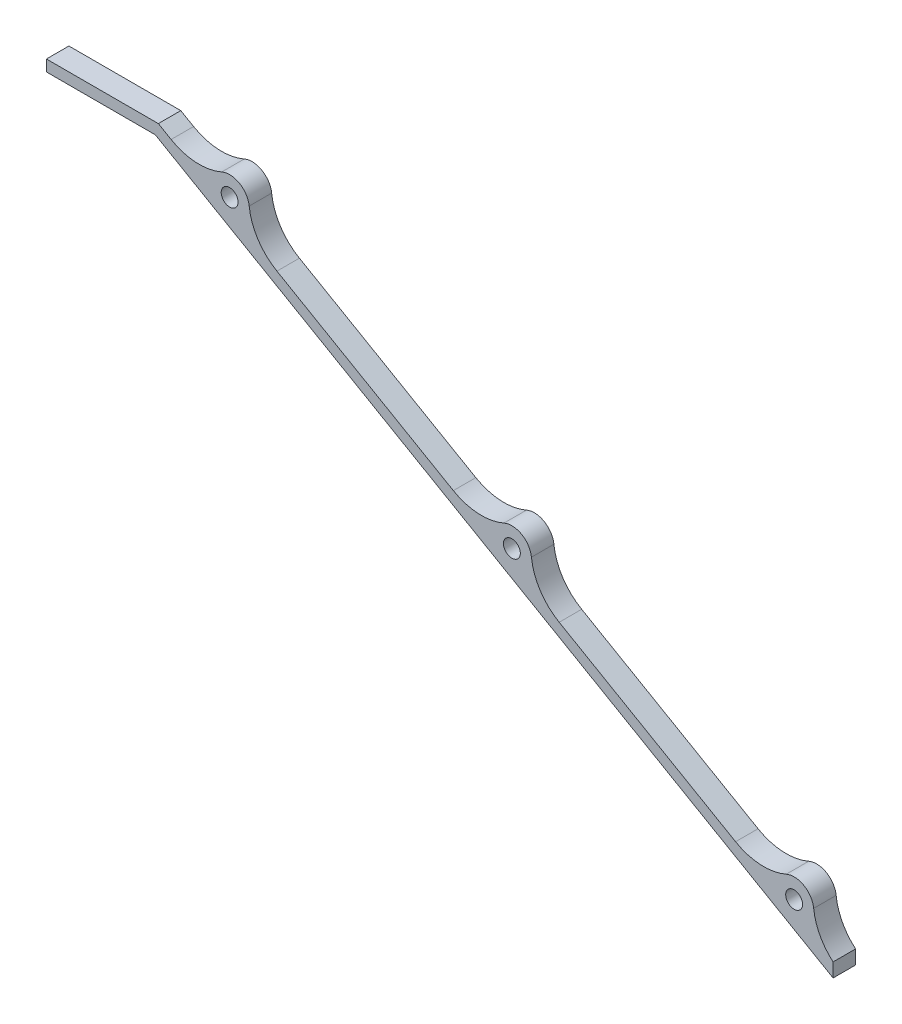
from build123d import *

# Parameters (mm, degrees)
EXTRUDE_THIN1_DEPTH = 4
SKETCH4_R           = 1.5
BOSS_EXTRUDE1_DEPTH = 4
FILLET1_DEPTH       = 4
CUT_EXTRUDE2_START  = -4
CUT_EXTRUDE2_DEPTH  = 4


with BuildPart() as part:
    # Sketch1 → Extrude-Thin1 (new body)
    with BuildSketch(Plane.XY):
        Polygon((-70, 98), (-50.621778265, 98), (70, 28.358983849), (71, 30.091034656), (-50.08587988, 100), (-70, 100), align=None)
    extrude(amount=EXTRUDE_THIN1_DEPTH)

    # Sketch4 → Boss-Extrude1 (add)
    # profile 1 of 9: a face of its own
    with BuildSketch(Plane(origin=(0, 0, 0), x_dir=(-1, 0, 0), z_dir=(0, 0, -1))):
        with BuildLine():
            ThreePointArc((40.894536929, 94.982050808), (40.775277321, 95.887917465), (40.425625842, 96.732050808))
            ThreePointArc((40.425625842, 96.732050808), (35.644536929, 98.013139721), (34.363448016, 93.232050808))
            ThreePointArc((34.363448016, 93.232050808), (35.026593255, 92.40467952), (35.907068336, 91.813859338))
            Line((35.907068336, 91.813859338), (40.882005522, 94.686140662))
            ThreePointArc((40.882005522, 94.686140662), (40.891402674, 94.833963122), (40.894536929, 94.982050808))
        make_face()
        with Locations((37.394536929, 94.982050808)):
            Circle(SKETCH4_R, mode=Mode.SUBTRACT)
    # profile 2 of 9: a face of its own
    with BuildSketch(Plane(origin=(0, 0, 0), x_dir=(-1, 0, 0), z_dir=(0, 0, -1))):
        with BuildLine():
            Line((41.425625842, 95), (40.425625842, 96.732050808))
            ThreePointArc((40.425625842, 96.732050808), (40.775277321, 95.887917465), (40.894536929, 94.982050808))
            ThreePointArc((40.894536929, 94.982050808), (40.891402674, 94.833963122), (40.882005522, 94.686140662))
            Line((40.882005522, 94.686140662), (41.425625842, 95))
        make_face()
    # profile 3 of 9: a face of its own
    with BuildSketch(Plane(origin=(0, 0, 0), x_dir=(-1, 0, 0), z_dir=(0, 0, -1))):
        with BuildLine():
            ThreePointArc((35.907068336, 91.813859338), (35.026593255, 92.40467952), (34.363448016, 93.232050808))
            Line((34.363448016, 93.232050808), (35.363448016, 91.5))
            Line((35.363448016, 91.5), (35.907068336, 91.813859338))
        make_face()
    # profile 4 of 9: a face of its own
    with BuildSketch(Plane(origin=(0, 0, 0), x_dir=(-1, 0, 0), z_dir=(0, 0, -1))):
        with BuildLine():
            ThreePointArc((-9.334936491, 65.982050808), (-9.454196099, 66.887917465), (-9.803847577, 67.732050808))
            ThreePointArc((-9.803847577, 67.732050808), (-14.584936491, 69.013139721), (-15.866025404, 64.232050808))
            ThreePointArc((-15.866025404, 64.232050808), (-15.202880165, 63.40467952), (-14.322405083, 62.813859338))
            Line((-14.322405083, 62.813859338), (-9.347467898, 65.686140662))
            ThreePointArc((-9.347467898, 65.686140662), (-9.338070746, 65.833963122), (-9.334936491, 65.982050808))
        make_face()
        with Locations((-12.834936491, 65.982050808)):
            Circle(SKETCH4_R, mode=Mode.SUBTRACT)
    # profile 5 of 9: a face of its own
    with BuildSketch(Plane(origin=(0, 0, 0), x_dir=(-1, 0, 0), z_dir=(0, 0, -1))):
        with BuildLine():
            ThreePointArc((-14.322405083, 62.813859338), (-15.202880165, 63.40467952), (-15.866025404, 64.232050808))
            Line((-15.866025404, 64.232050808), (-14.866025404, 62.5))
            Line((-14.866025404, 62.5), (-14.322405083, 62.813859338))
        make_face()
    # profile 6 of 9: a face of its own
    with BuildSketch(Plane(origin=(0, 0, 0), x_dir=(-1, 0, 0), z_dir=(0, 0, -1))):
        with BuildLine():
            Line((-9.347467898, 65.686140662), (-8.803847577, 66))
            Line((-8.803847577, 66), (-9.803847577, 67.732050808))
            ThreePointArc((-9.803847577, 67.732050808), (-9.454196099, 66.887917465), (-9.334936491, 65.982050808))
            ThreePointArc((-9.334936491, 65.982050808), (-9.338070746, 65.833963122), (-9.347467898, 65.686140662))
        make_face()
    # profile 7 of 9: a face of its own
    with BuildSketch(Plane(origin=(0, 0, 0), x_dir=(-1, 0, 0), z_dir=(0, 0, -1))):
        with BuildLine():
            ThreePointArc((-59.56440991, 36.982050808), (-59.683669518, 37.887917465), (-60.033320997, 38.732050808))
            ThreePointArc((-60.033320997, 38.732050808), (-64.81440991, 40.013139721), (-66.095498823, 35.232050808))
            ThreePointArc((-66.095498823, 35.232050808), (-65.432353584, 34.40467952), (-64.551878503, 33.813859338))
            Line((-64.551878503, 33.813859338), (-59.576941317, 36.686140662))
            ThreePointArc((-59.576941317, 36.686140662), (-59.567544165, 36.833963122), (-59.56440991, 36.982050808))
        make_face()
        with Locations((-63.06440991, 36.982050808)):
            Circle(SKETCH4_R, mode=Mode.SUBTRACT)
    # profile 8 of 9: a face of its own
    with BuildSketch(Plane(origin=(0, 0, 0), x_dir=(-1, 0, 0), z_dir=(0, 0, -1))):
        with BuildLine():
            ThreePointArc((-64.551878503, 33.813859338), (-65.432353584, 34.40467952), (-66.095498823, 35.232050808))
            Line((-66.095498823, 35.232050808), (-65.095498823, 33.5))
            Line((-65.095498823, 33.5), (-64.551878503, 33.813859338))
        make_face()
    # profile 9 of 9: a face of its own
    with BuildSketch(Plane(origin=(0, 0, 0), x_dir=(-1, 0, 0), z_dir=(0, 0, -1))):
        with BuildLine():
            Line((-59.576941317, 36.686140662), (-59.033320997, 37))
            Line((-59.033320997, 37), (-60.033320997, 38.732050808))
            ThreePointArc((-60.033320997, 38.732050808), (-59.683669518, 37.887917465), (-59.56440991, 36.982050808))
            ThreePointArc((-59.56440991, 36.982050808), (-59.567544165, 36.833963122), (-59.576941317, 36.686140662))
        make_face()
    extrude(amount=-BOSS_EXTRUDE1_DEPTH)

    # Fillet1: read off the stored shape, not the designer's step
    # Fillet1 outline → Fillet1 (add)
    with BuildSketch(Plane.XY):
        with BuildLine():
            ThreePointArc((60.033320997, 38.732050808), (60.730207809, 39.590019471), (61.659897736, 40.18788074))
            ThreePointArc((61.659897736, 40.18788074), (57.09391383, 39.362702083), (52.647005809, 40.687140793))
            Line((52.647005809, 40.687140793), (59.033320997, 37))
            Line((59.033320997, 37), (60.033320997, 38.732050808))
        make_face()
        with BuildLine():
            ThreePointArc((-40.425625842, 96.732050808), (-39.72873903, 97.590019471), (-38.799049103, 98.18788074))
            ThreePointArc((-38.799049103, 98.18788074), (-43.365033009, 97.362702083), (-47.81194103, 98.687140793))
            Line((-47.81194103, 98.687140793), (-41.425625842, 95))
            Line((-41.425625842, 95), (-40.425625842, 96.732050808))
        make_face()
        with BuildLine():
            Line((-35.363448016, 91.5), (-28.977132828, 87.812859207))
            ThreePointArc((-28.977132828, 87.812859207), (-32.347584407, 91.001775167), (-33.915950681, 95.368622551))
            ThreePointArc((-33.915950681, 95.368622551), (-33.968868764, 94.264556822), (-34.363448016, 93.232050808))
            Line((-34.363448016, 93.232050808), (-35.363448016, 91.5))
        make_face()
        with BuildLine():
            ThreePointArc((9.803847577, 67.732050808), (10.500734389, 68.590019472), (11.430424316, 69.18788074))
            ThreePointArc((11.430424316, 69.18788074), (6.864440411, 68.362702083), (2.41753239, 69.687140793))
            Line((2.41753239, 69.687140793), (8.803847577, 66))
            Line((8.803847577, 66), (9.803847577, 67.732050808))
        make_face()
        with BuildLine():
            Line((14.866025404, 62.5), (21.252340591, 58.812859207))
            ThreePointArc((21.252340591, 58.812859207), (17.881889013, 62.001775167), (16.313522739, 66.368622551))
            ThreePointArc((16.313522739, 66.368622551), (16.260604656, 65.264556823), (15.866025404, 64.232050808))
            Line((15.866025404, 64.232050808), (14.866025404, 62.5))
        make_face()
        with BuildLine():
            ThreePointArc((71, 30.091034656), (67.95755311, 33.22829735), (66.543566366, 37.363456571))
            ThreePointArc((66.543566366, 37.363456571), (66.489544407, 36.262013533), (66.095498823, 35.232050808))
            Line((66.095498823, 35.232050808), (65.095498823, 33.5))
            Line((65.095498823, 33.5), (71, 30.091034656))
        make_face()
    extrude(amount=FILLET1_DEPTH)

    # Sketch5 → Cut-Extrude2 (cut)
    with BuildSketch(Plane.XY.offset(4).offset(CUT_EXTRUDE2_START)):
        with BuildLine():
            Line((71, 30.091034656), (70, 28.358983849))
            Line((70, 28.358983849), (72.530271162, 28.358983849))
            Line((72.530271162, 28.358983849), (72.530271162, 31.310199794))
            Line((72.530271162, 31.310199794), (70, 31.310199794))
            Line((70, 31.310199794), (70, 30.840200363))
            ThreePointArc((70, 30.840200363), (70.488287532, 30.449983494), (71, 30.091034656))
        make_face()
        with BuildLine():
            Line((70, 30.840200363), (70, 28.358983849))
            Line((70, 28.358983849), (71, 30.091034656))
            ThreePointArc((71, 30.091034656), (70.488287532, 30.449983494), (70, 30.840200363))
        make_face()
    extrude(amount=CUT_EXTRUDE2_DEPTH, mode=Mode.SUBTRACT)


solid = part.part
